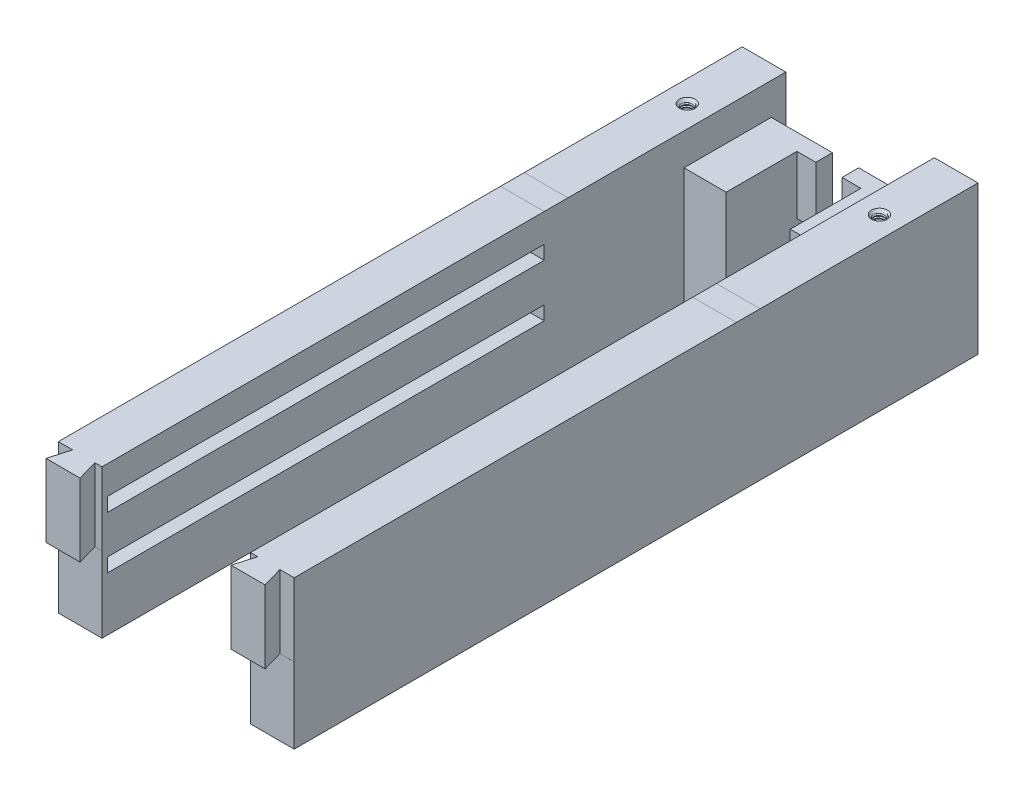
from build123d import *

# Parameters (mm, degrees)
SKETCH1_W                      = 242
SKETCH1_H                      = 51
BOSS_EXTRUDE1_DEPTH            = 15
SKETCH26_W                     = 30
SKETCH26_H                     = 40
BOSS_EXTRUDE3_DEPTH            = 29.5
SKETCH28_W                     = 15
SKETCH28_H                     = 9.75
BOSS_EXTRUDE5_DEPTH            = 4.5
SKETCH29_W                     = 5.7
SKETCH29_H                     = 20
BOSS_EXTRUDE6_DEPTH            = 6.5
CUT_EXTRUDE8_DEPTH             = 25
SKETCH13_W                     = 15
SKETCH13_H                     = 7.11
CUT_EXTRUDE9_DEPTH             = 26
SKETCH17_W                     = 15
SKETCH17_H                     = 8.15
CUT_EXTRUDE10_DEPTH            = 0.0001
SKETCH7_W                      = 4.75
SKETCH7_H                      = 4.75
CUT_EXTRUDE5_DEPTH             = 150
F_8_32_TAPPED_HOLE1_AT_2_COUNT = 2
F_8_32_TAPPED_HOLE1_AT_2_PITCH = 66
THREAD3_PITCH                  = 0.79375
THREAD4_PITCH                  = 0.79375


with BuildPart() as part:
    # Sketch1 → Boss-Extrude1 (new body)
    with BuildSketch(Plane(origin=(0, 0, 0), x_dir=(0, 0, -1), z_dir=(1, 0, 0))):
        with Locations((56.437921078, 5.057266603)):
            Rectangle(SKETCH1_W, SKETCH1_H)
    extrude(amount=BOSS_EXTRUDE1_DEPTH)

    # Sketch26 → Boss-Extrude3 (add)
    with BuildSketch(Plane.ZY):
        with Locations((-157.437921078, -0.442733397)):
            Rectangle(SKETCH26_W, SKETCH26_H)
    extrude(amount=-BOSS_EXTRUDE3_DEPTH)

    # Sketch28 → Boss-Extrude5 (add)
    with BuildSketch(Plane(origin=(29.5, 0, 0), x_dir=(0, 0, -1), z_dir=(1, 0, 0))):
        with Locations((154.541661602, -15.567733397)):
            Rectangle(SKETCH28_W, SKETCH28_H)
    extrude(amount=BOSS_EXTRUDE5_DEPTH)

    # Sketch29 → Boss-Extrude6 (add)
    with BuildSketch(Plane(origin=(29.5, 0, 0), x_dir=(0, 0, -1), z_dir=(1, 0, 0))):
        with Locations((169.587921078, 9.557266603)):
            Rectangle(SKETCH29_W, SKETCH29_H)
    extrude(amount=BOSS_EXTRUDE6_DEPTH)

    # Sketch12 → Cut-Extrude8 (cut)
    with BuildSketch(Plane(origin=(0, 30.557266603, 0), x_dir=(1, 0, 0), z_dir=(0, 1, 0))):
        Polygon((0, -57.448742372), (4.909716433, -57.448742372), (2.87, -64.562078922), (0, -64.562078922), align=None)
        Polygon((15, -57.448742372), (15, -64.562078922), (14.57, -64.562078922), (12.530283567, -57.448742372), align=None)
    extrude(amount=-CUT_EXTRUDE8_DEPTH, mode=Mode.SUBTRACT)

    # Sketch13 → Cut-Extrude9 (cut)
    with BuildSketch(Plane.XZ.offset(20.442733397)):
        with Locations((7.5, 61.007078922)):
            Rectangle(SKETCH13_W, SKETCH13_H)
    extrude(amount=-CUT_EXTRUDE9_DEPTH, mode=Mode.SUBTRACT)

    # Sketch17 → Cut-Extrude10 (cut)
    with BuildSketch(Plane(origin=(0, 30.557266603, 0), x_dir=(1, 0, 0), z_dir=(0, 1, 0))):
        with Locations((7.5, 98.512921078)):
            Rectangle(SKETCH17_W, SKETCH17_H)
    extrude(amount=-CUT_EXTRUDE10_DEPTH, mode=Mode.SUBTRACT)

    # Sketch7 → Cut-Extrude5 (cut)
    with BuildSketch(Plane(origin=(0, 0, -94.437921078), x_dir=(-1, 0, 0), z_dir=(0, 0, -1))):
        with Locations((-12.625, 0.432266603)):
            Rectangle(SKETCH7_W, SKETCH7_H)
        with Locations((-12.625, 18.432266603)):
            Rectangle(SKETCH7_W, SKETCH7_H)
    extrude(amount=-CUT_EXTRUDE5_DEPTH, mode=Mode.SUBTRACT)


with BuildPart() as body_2:
    # Mirror4: mirrored copy
    add(part.part.mirror(Plane(origin=(40.5, 0, 0), x_dir=(0, 0, 1), z_dir=(1, 0, 0))))


with BuildPart() as part_1:
    add(part.part)

    # Sketch37 → #8-32 Tapped Hole1 (revolve, cut)
    with BuildSketch(Plane(origin=(7.5, 30.557266603, -151.078683634), x_dir=(0, 0, 1), z_dir=(1, 0, 0))):
        Polygon((0, 0), (0, 10.70744), (1.7272, 9.669633539), (1.7272, 0.9906), (2.7178, 0), align=None)
    f_8_32_tapped_hole1 = revolve(axis=Axis((7.5, 36.907266603, -151.078683634), (0, -1, 0)), mode=Mode.SUBTRACT)

    # Thread3: arcs per turn and ends read off the stored shape
    # Thread3: the profile of Thread Profile5 profile screwed along a right-hand helix through 12.598425 turns, 8 arcs to a turn; built about Z, then put on its axis
    thread3_z = Axis((0, 0, 0), (0, 0, 1))
    thread3_corners = [(1.7269, 0, -0.000173205), (2.156829788, 0, 0.248046874), (2.156829788, 0, 0.347265624), (1.7269, 0, 0.595485703)]
    with BuildLine(mode=Mode.PRIVATE) as thread3_profile:
        Line(thread3_corners[0], thread3_corners[1])
        Line(thread3_corners[1], thread3_corners[2])
        Line(thread3_corners[2], thread3_corners[3])
        Line(thread3_corners[3], thread3_corners[0])
    thread3_cap = Face(thread3_profile.wire())
    thread3_turn_angles = [0, 22.5, 45, 67.5, 90, 112.5, 135, 157.5, 180, 202.5, 225, 247.5, 270, 292.5, 315, 337.5, 360]
    thread3_turn_weights = [1, 0.9238795325112867, 1, 0.9238795325112867, 1, 0.9238795325112867, 1, 0.9238795325112867, 1, 0.9238795325112867, 1, 0.9238795325112867, 1, 0.9238795325112867, 1, 0.9238795325112867, 1]
    thread3_turn_rails = [Edge.make_bspline([Vector(p[0], p[1], 0).rotate(thread3_z, thread3_turn_angles[k]) / thread3_turn_weights[k] + Vector(0, 0, p[2] + THREAD3_PITCH * thread3_turn_angles[k] / 360) for k in range(17)], [0, 0, 0, 1, 1, 2, 2, 3, 3, 4, 4, 5, 5, 6, 6, 7, 7, 8, 8, 8], 2, thread3_turn_weights) for p in thread3_corners]
    thread3_turn_sides = [Face.make_surface_from_curves(thread3_turn_rails[p[0]], thread3_turn_rails[p[1]]) for p in [(0, 1), (1, 2), (2, 3), (3, 0)]]
    thread3_last_angles = [4320, 4342.5, 4365, 4387.5, 4410, 4432.5, 4455, 4477.5, 4500, 4517.716535433, 4535.433070866]
    thread3_last_weights = [1, 0.9238795325112867, 1, 0.9238795325112867, 1, 0.9238795325112867, 1, 0.9238795325112867, 1, 0.9525736983244454, 1]
    thread3_last_rails = [Edge.make_bspline([Vector(p[0], p[1], 0).rotate(thread3_z, thread3_last_angles[k]) / thread3_last_weights[k] + Vector(0, 0, p[2] + THREAD3_PITCH * thread3_last_angles[k] / 360) for k in range(11)], [0, 0, 0, 1, 1, 2, 2, 3, 3, 4, 4, 5, 5, 5], 2, thread3_last_weights) for p in thread3_corners]
    thread3_last_sides = [Face.make_surface_from_curves(thread3_last_rails[p[0]], thread3_last_rails[p[1]]) for p in [(0, 1), (1, 2), (2, 3), (3, 0)]]
    thread3 = Plane(origin=(7.5, 30.566666603, -151.078683634), x_dir=(-1, 0, 0), z_dir=(0, -1, 0)) * Solid(Shell([*[p.moved(Location((0, 0, THREAD3_PITCH * i))) for i in range(12) for p in thread3_turn_sides], *thread3_last_sides, thread3_cap, thread3_cap.rotate(thread3_z, 4535.433070866).moved(Location((0, 0, THREAD3_PITCH * 4535.433070866 / 360)))]))
    add(thread3, mode=Mode.SUBTRACT)


with BuildPart() as body_2_1:
    add(body_2.part)

    # #8-32 Tapped Hole1 at 2: #8-32 Tapped Hole1 ×2
    with Locations(*[(i * F_8_32_TAPPED_HOLE1_AT_2_PITCH, 0, 0) for i in range(1, F_8_32_TAPPED_HOLE1_AT_2_COUNT)]):
        add(f_8_32_tapped_hole1, mode=Mode.SUBTRACT)

    # Thread4: arcs per turn and ends read off the stored shape
    # Thread4: the profile of Thread Profile6 profile screwed along a right-hand helix through 12.598425 turns, 8 arcs to a turn; built about Z, then put on its axis
    thread4_z = Axis((0, 0, 0), (0, 0, 1))
    thread4_corners = [(1.7269, 0, -0.000173205), (2.156829788, 0, 0.248046874), (2.156829788, 0, 0.347265624), (1.7269, 0, 0.595485703)]
    with BuildLine(mode=Mode.PRIVATE) as thread4_profile:
        Line(thread4_corners[0], thread4_corners[1])
        Line(thread4_corners[1], thread4_corners[2])
        Line(thread4_corners[2], thread4_corners[3])
        Line(thread4_corners[3], thread4_corners[0])
    thread4_cap = Face(thread4_profile.wire())
    thread4_turn_angles = [0, 22.5, 45, 67.5, 90, 112.5, 135, 157.5, 180, 202.5, 225, 247.5, 270, 292.5, 315, 337.5, 360]
    thread4_turn_weights = [1, 0.9238795325112867, 1, 0.9238795325112867, 1, 0.9238795325112867, 1, 0.9238795325112867, 1, 0.9238795325112867, 1, 0.9238795325112867, 1, 0.9238795325112867, 1, 0.9238795325112867, 1]
    thread4_turn_rails = [Edge.make_bspline([Vector(p[0], p[1], 0).rotate(thread4_z, thread4_turn_angles[k]) / thread4_turn_weights[k] + Vector(0, 0, p[2] + THREAD4_PITCH * thread4_turn_angles[k] / 360) for k in range(17)], [0, 0, 0, 1, 1, 2, 2, 3, 3, 4, 4, 5, 5, 6, 6, 7, 7, 8, 8, 8], 2, thread4_turn_weights) for p in thread4_corners]
    thread4_turn_sides = [Face.make_surface_from_curves(thread4_turn_rails[p[0]], thread4_turn_rails[p[1]]) for p in [(0, 1), (1, 2), (2, 3), (3, 0)]]
    thread4_last_angles = [4320, 4342.5, 4365, 4387.5, 4410, 4432.5, 4455, 4477.5, 4500, 4517.716535433, 4535.433070866]
    thread4_last_weights = [1, 0.9238795325112867, 1, 0.9238795325112867, 1, 0.9238795325112867, 1, 0.9238795325112867, 1, 0.9525736983244454, 1]
    thread4_last_rails = [Edge.make_bspline([Vector(p[0], p[1], 0).rotate(thread4_z, thread4_last_angles[k]) / thread4_last_weights[k] + Vector(0, 0, p[2] + THREAD4_PITCH * thread4_last_angles[k] / 360) for k in range(11)], [0, 0, 0, 1, 1, 2, 2, 3, 3, 4, 4, 5, 5, 5], 2, thread4_last_weights) for p in thread4_corners]
    thread4_last_sides = [Face.make_surface_from_curves(thread4_last_rails[p[0]], thread4_last_rails[p[1]]) for p in [(0, 1), (1, 2), (2, 3), (3, 0)]]
    thread4 = Plane(origin=(73.5, 30.566666603, -151.078683634), x_dir=(-1, 0, 0), z_dir=(0, -1, 0)) * Solid(Shell([*[p.moved(Location((0, 0, THREAD4_PITCH * i))) for i in range(12) for p in thread4_turn_sides], *thread4_last_sides, thread4_cap, thread4_cap.rotate(thread4_z, 4535.433070866).moved(Location((0, 0, THREAD4_PITCH * 4535.433070866 / 360)))]))
    add(thread4, mode=Mode.SUBTRACT)


solid = Compound([part_1.part, body_2_1.part])
